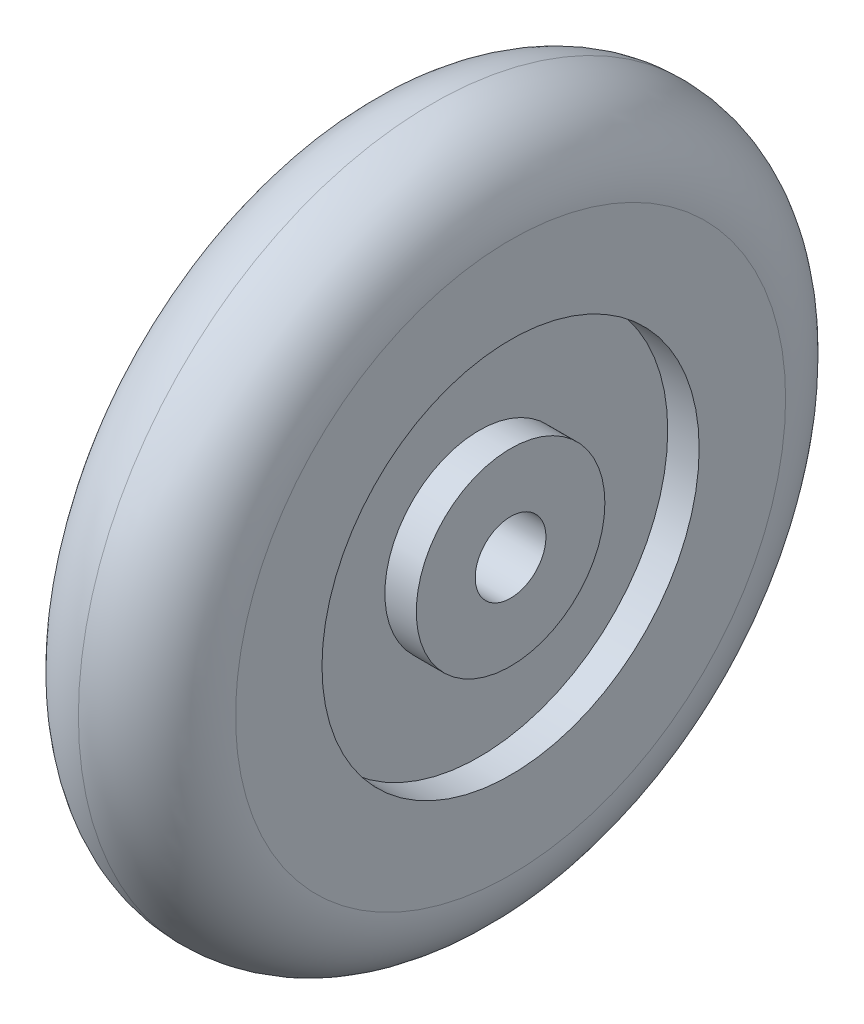
from build123d import *

# Parameters (mm, degrees)
SKETCH2_R           = 22.5
BOSS_EXTRUDE1_DEPTH = 5
FILLET1_R           = 5
SKETCH3_R           = 12
SKETCH3_R_2         = 6
CUT_EXTRUDE1_DEPTH  = 2
SKETCH4_R           = 2.25
CUT_EXTRUDE2_DEPTH  = 34.354160228


with BuildPart() as part:
    # Sketch2 → Boss-Extrude1 (new, symmetric)
    with BuildSketch(Plane(origin=(0, 0, 0), x_dir=(0, 0, -1), z_dir=(1, 0, 0))):
        Circle(SKETCH2_R)
    extrude(amount=BOSS_EXTRUDE1_DEPTH, both=True)

    # Fillet1
    fillet1_edges = [part.edges().sort_by_distance(p)[0] for p in [
        (-5, 0, 22.5),
        (5, 0, 22.5),
    ]]
    fillet(fillet1_edges, radius=FILLET1_R - 0.0001)  # a hair under: the kernel refuses the full size

    # Sketch3 → Cut-Extrude1 (cut)
    with BuildSketch(Plane(origin=(5, 0, 0), x_dir=(0, 0, -1), z_dir=(1, 0, 0))):
        Circle(SKETCH3_R)
        Circle(SKETCH3_R_2, mode=Mode.SUBTRACT)
    cut_extrude1 = extrude(amount=-CUT_EXTRUDE1_DEPTH, mode=Mode.SUBTRACT)

    # Mirror1: Cut-Extrude1 across plane
    add(cut_extrude1.mirror(Plane(origin=(0, 0, 0), x_dir=(0, 0, 1), z_dir=(1, 0, 0))), mode=Mode.SUBTRACT)

    # Sketch4 → Cut-Extrude2 (cut, through all)
    with BuildSketch(Plane(origin=(5, 0, 0), x_dir=(0, 0, -1), z_dir=(1, 0, 0))):
        Circle(SKETCH4_R)
    extrude(amount=-CUT_EXTRUDE2_DEPTH, mode=Mode.SUBTRACT)


solid = part.part
